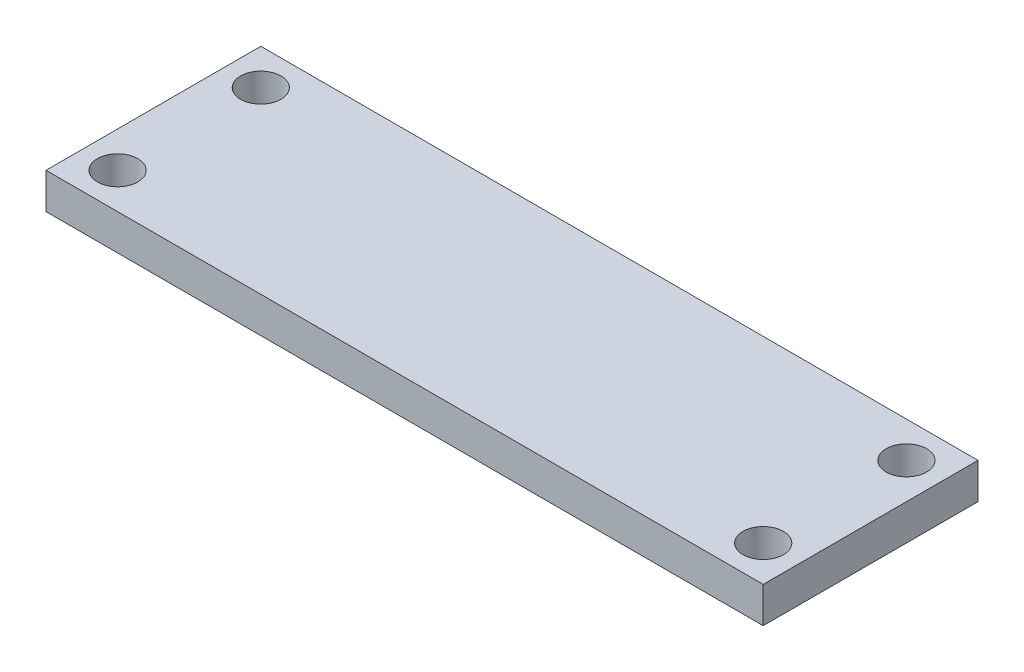
from build123d import *

# Parameters (mm, degrees)
SKETCH1_W           = 40.07
SKETCH1_H           = 12
SKETCH1_R           = 1.1303
BOSS_EXTRUDE1_DEPTH = 2


with BuildPart() as part:
    # Sketch1 → Boss-Extrude1 (new body)
    with BuildSketch(Plane(origin=(0, 0, 0), x_dir=(1, 0, 0), z_dir=(0, 1, 0))):
        with Locations((20.035, -6)):
            Rectangle(SKETCH1_W, SKETCH1_H)
        with Locations((38.07, -2)):
            Circle(SKETCH1_R, mode=Mode.SUBTRACT)
        with Locations((38.07, -10)):
            Circle(SKETCH1_R, mode=Mode.SUBTRACT)
        with Locations((2, -10)):
            Circle(SKETCH1_R, mode=Mode.SUBTRACT)
        with Locations((2, -2)):
            Circle(SKETCH1_R, mode=Mode.SUBTRACT)
    extrude(amount=BOSS_EXTRUDE1_DEPTH)


solid = part.part
